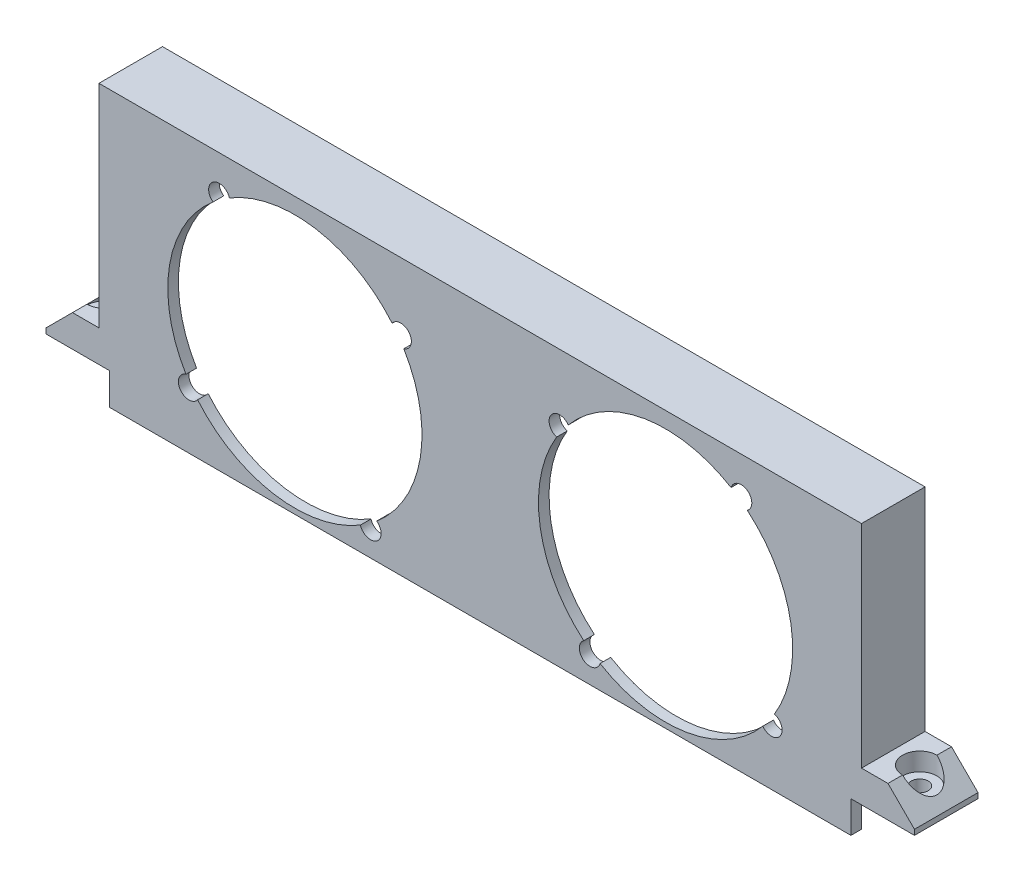
from build123d import *

# Parameters (mm, degrees)
SZKIC1_W                    = 140
SZKIC1_H                    = 50
DODANIE_WYCI_GNI_CIE1_DEPTH = 2
DODANIE_WYCI_GNI_CIE2_DEPTH = 12
SFAZOWANIE1_SIZE            = 5


with BuildPart() as part:
    # Szkic1 → Dodanie-wyciągnięcie1 (new body)
    with BuildSketch(Plane.XY):
        Rectangle(SZKIC1_W, SZKIC1_H)
        with BuildLine():
            ThreePointArc((-14.432240892, 12.367994391), (-11.873973335, 6.417701356), (-11, 0))
            ThreePointArc((-11, 0), (-13.243691419, -10.132276987), (-19.555253078, -18.370078729))
            ThreePointArc((-19.555253078, -18.370078729), (-18.936918944, -19.082957273), (-18.714285714, -20))
            ThreePointArc((-18.714285714, -20), (-20.427440625, -21.97932309), (-22.632005609, -20.567759108))
            ThreePointArc((-22.632005609, -20.567759108), (-38.945575695, -23.673454172), (-53.370078729, -15.444746922))
            ThreePointArc((-53.370078729, -15.444746922), (-56.627466942, -15.448190673), (-55.567759108, -12.367994391))
            ThreePointArc((-55.567759108, -12.367994391), (-58.673454172, 3.945575695), (-50.444746922, 18.370078729))
            ThreePointArc((-50.444746922, 18.370078729), (-50.448190673, 21.627466942), (-47.367994391, 20.567759108))
            ThreePointArc((-47.367994391, 20.567759108), (-31.054424305, 23.673454172), (-16.629921271, 15.444746922))
            ThreePointArc((-16.629921271, 15.444746922), (-14.391659035, 16.190949513), (-13, 14.285714286))
            ThreePointArc((-13, 14.285714286), (-13.397577113, 13.088951614), (-14.432240892, 12.367994391))
        make_face(mode=Mode.SUBTRACT)
        with BuildLine():
            ThreePointArc((50.444746922, 18.370078729), (56.756308581, 10.132276987), (59, 0))
            ThreePointArc((59, 0), (58.126026665, -6.417701356), (55.567759108, -12.367994391))
            ThreePointArc((55.567759108, -12.367994391), (56.602422887, -13.088951614), (57, -14.285714286))
            ThreePointArc((57, -14.285714286), (55.608340965, -16.190949513), (53.370078729, -15.444746922))
            ThreePointArc((53.370078729, -15.444746922), (38.945575695, -23.673454172), (22.632005609, -20.567759108))
            ThreePointArc((22.632005609, -20.567759108), (19.551809327, -21.627466942), (19.555253078, -18.370078729))
            ThreePointArc((19.555253078, -18.370078729), (11.326545828, -3.945575695), (14.432240892, 12.367994391))
            ThreePointArc((14.432240892, 12.367994391), (13.372533058, 15.448190673), (16.629921271, 15.444746922))
            ThreePointArc((16.629921271, 15.444746922), (31.054424305, 23.673454172), (47.367994391, 20.567759108))
            ThreePointArc((47.367994391, 20.567759108), (49.572559375, 21.97932309), (51.285714286, 20))
            ThreePointArc((51.285714286, 20), (51.063081056, 19.082957273), (50.444746922, 18.370078729))
        make_face(mode=Mode.SUBTRACT)
    extrude(amount=DODANIE_WYCI_GNI_CIE1_DEPTH)

    # Szkic2 → Dodanie-wyciągnięcie2 (add)
    with BuildSketch(Plane.XY.offset(2)):
        Polygon((70, 25), (70, -19), (82, -19), (82, -13), (72, -13), (72, 27), (-72, 27), (-72, -13), (-82, -13), (-82, -19), (-70, -19), (-70, 25), align=None)
    extrude(amount=-DODANIE_WYCI_GNI_CIE2_DEPTH)

    # Szkic4 → CBORE for M3 Hex Socket Head Cap Screw1 (revolve, cut)
    with BuildSketch(Plane(origin=(-77, -13, -4), x_dir=(0, 0, 1), z_dir=(1, 0, 0))):
        Polygon((0, 0), (0, 8.66137699), (1.6, 7.7), (1.6, 3.4), (3.25, 3.4), (3.25, 0), align=None)
    cbore_for_m3_hex_socket_head_cap_screw1 = revolve(axis=Axis((-77, -6.65, -4), (0, -1, 0)), mode=Mode.SUBTRACT)

    # Lustro1: CBORE for M3 Hex Socket Head Cap Screw1 across plane
    add(cbore_for_m3_hex_socket_head_cap_screw1.mirror(Plane(origin=(0, 0, 0), x_dir=(0, 0, 1), z_dir=(1, 0, 0))), mode=Mode.SUBTRACT)

    # Sfazowanie1
    # the kernel refuses this chamfer: 5 mm, written as the material it takes off along each edge
    with BuildSketch(Plane(origin=(-82, -13, 14.85841494), x_dir=(0.9996219169112968, 0.027495876610586625, 0), z_dir=(0, 0, -1)), Plane(origin=(82, -13, 14.85841494), x_dir=(0.027495876610590466, -0.9996219169112965, 0), z_dir=(0, 0, -1))) as sfazowanie1_piece_1:
        Polygon((SFAZOWANIE1_SIZE * 0.999621916911, SFAZOWANIE1_SIZE * 0.0274958766106), (-SFAZOWANIE1_SIZE * 0.0274958766106, SFAZOWANIE1_SIZE * 0.999621916911), (0, 0), align=None)
    extrude(amount=37.71682988, mode=Mode.SUBTRACT)


solid = part.part
